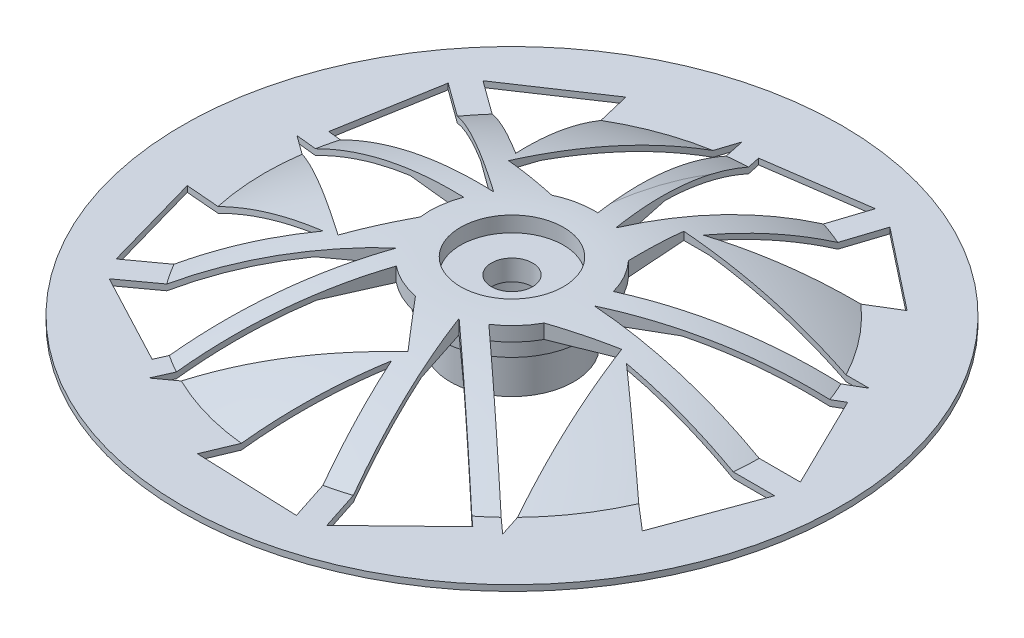
from build123d import *

# Parameters (mm, degrees)
CUT_EXTRUDE1_DEPTH = 145.741351761


with BuildPart() as part:
    # Sketch1 → Revolve1 (revolve)
    with BuildSketch(Plane.XY):
        with BuildLine():
            Line((15.875, 23.8125), (15.875, 19.05))
            Line((15.875, 19.05), (6.35, 19.05))
            Line((6.35, 19.05), (6.35, 12.7))
            Line((6.35, 12.7), (15.875, 12.7))
            Line((15.875, 12.7), (15.875, 0))
            Line((15.875, 0), (19.05, 0))
            Line((19.05, 0), (19.05, 12.7))
            Line((19.05, 12.7), (22.225, 12.7))
            Line((22.225, 12.7), (22.225, 19.05))
            Line((22.225, 19.05), (43.59040411, 19.05))
            ThreePointArc((43.59040411, 19.05), (60.350843882, 13.869944553), (76.2, 6.35))
            Line((76.2, 6.35), (101.6, 6.35))
            Line((101.6, 6.35), (101.6, 8.170021573))
            Line((101.6, 8.170021573), (76.2, 8.170021573))
            ThreePointArc((76.2, 8.170021573), (47.035041545, 19.838265849), (15.875, 23.8125))
        make_face()
    revolve(axis=Axis((0, 0, 0), (0, 1, 0)))

    # Sketch3 → Cut-Extrude1 (cut, through all)
    with BuildSketch(Plane(origin=(0, 6.35, 0), x_dir=(-1, 0, 0), z_dir=(0, -1, 0))):
        with BuildLine():
            Line((-74.467982483, 35.661761314), (-24.473547486, 6.79746081))
            ThreePointArc((-24.473547486, 6.79746081), (-22.154216338, 12.423795654), (-18.563138509, 17.33695154))
            Line((-18.563138509, 17.33695154), (-17.317982483, 35.661761314))
            Line((-17.317982483, 35.661761314), (-74.467982483, 35.661761314))
        make_face()
        Polygon((-20.513285346, 38.46203914), (-34.62113694, 81.881541736), (-59.56487434, 62.237904992), align=None)
        Polygon((-88.9, 0), (-25.4, 0), (-74.893351826, 28.575), align=None)
        Polygon((-7.849031657, 24.156835514), (4.033121473, 80.057970896), (-27.4716108, 84.548924299), align=None)
        with BuildLine():
            ThreePointArc((-14.027511483, -21.175195904), (-18.661761159, -17.23074782), (-22.224746003, -12.297181185))
            Line((-22.224746003, -12.297181185), (-39.267901376, -5.450289794))
            Line((-39.267901376, -5.450289794), (-56.928222604, -59.803169701))
            Line((-56.928222604, -59.803169701), (-14.027511483, -21.175195904))
        make_face()
        Polygon((-77.598323543, -37.416991546), (-42.918526737, -7.623869966), (-88.572493511, -7.623869966), align=None)
        with BuildLine():
            ThreePointArc((-1.097972688, 25.376257722), (4.969702468, 24.909075803), (10.752095467, 23.012006498))
            Line((10.752095467, 23.012006498), (28.564799585, 27.490470385))
            Line((28.564799585, 27.490470385), (10.904478356, 81.843350291))
            Line((10.904478356, 81.843350291), (-1.097972688, 25.376257722))
        make_face()
        Polygon((-7.849031657, -24.156835514), (-50.319758433, -62.397649667), (-27.4716108, -84.548924299), align=None)
        Polygon((20.549031657, 14.929745408), (77.385957977, 20.903547084), (71.9216108, 52.254108929), align=None)
        with BuildLine():
            ThreePointArc((15.804068611, -19.884451597), (10.620613652, -23.072983458), (4.827490088, -24.937027478))
            Line((4.827490088, -24.937027478), (-6.950915234, -39.030225656))
            Line((-6.950915234, -39.030225656), (39.284405995, -72.622152824))
            Line((39.284405995, -72.622152824), (15.804068611, -19.884451597))
        make_face()
        Polygon((30.240619172, 31.394717431), (67.175454153, 58.22944581), (40.785206665, 75.88213222), align=None)
        with BuildLine():
            ThreePointArc((23.794963046, 8.885928969), (25.225661377, 2.970859821), (25.208298958, -3.114749375))
            Line((25.208298958, -3.114749375), (34.971999508, -18.671716249))
            Line((34.971999508, -18.671716249), (81.207320737, 14.920210919))
            Line((81.207320737, 14.920210919), (23.794963046, 8.885928969))
        make_face()
        Polygon((11.606472921, -85.362877525), (-6.011822925, -43.173849905), (-20.119674519, -86.5933525), align=None)
        Polygon((20.549031657, -14.929745408), (43.794030809, -67.138868312), (71.9216108, -52.254108929), align=None)
        Polygon((84.771518297, -15.340168141), (39.203015835, -19.059036701), (76.137850816, -45.893765079), align=None)
    extrude(amount=-CUT_EXTRUDE1_DEPTH, mode=Mode.SUBTRACT)


solid = part.part
